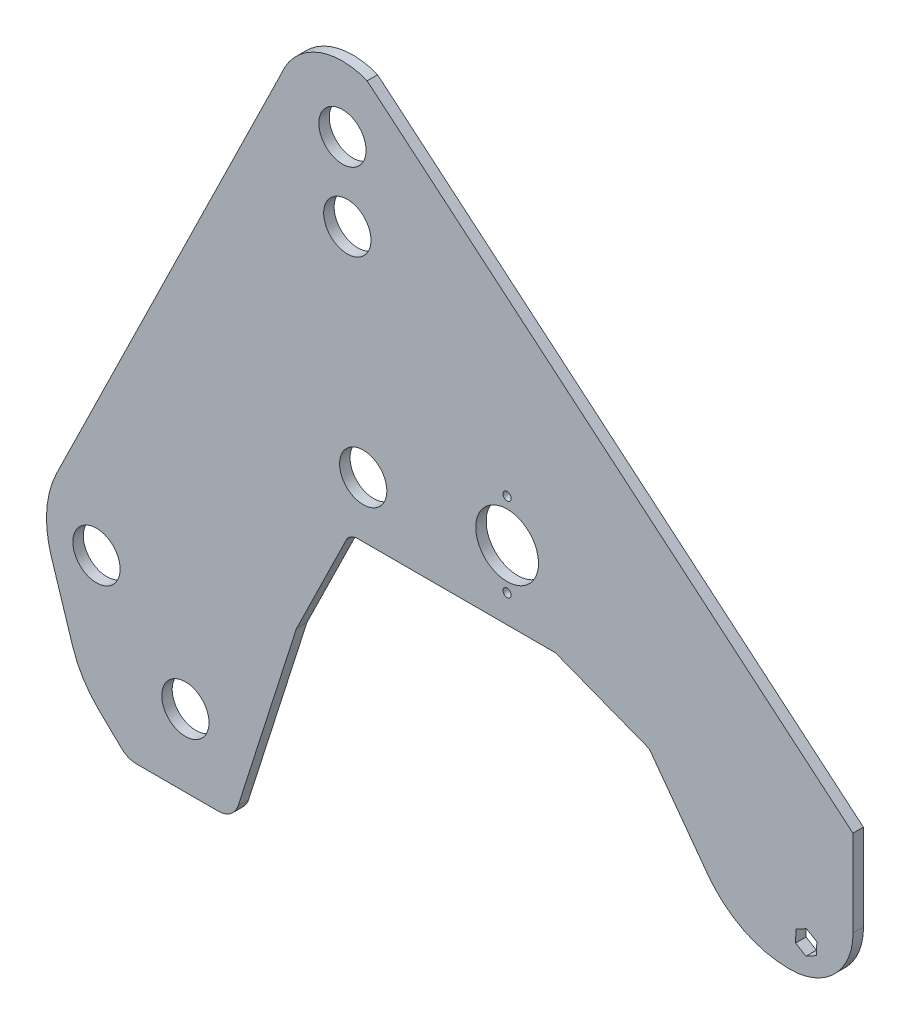
from build123d import *

# Parameters (mm, degrees)
MODEL_R             = 14.351
MODEL_R_2           = 2.4892
MODEL_R_3           = 19.05
BOSS_EXTRUDE1_DEPTH = 6.35


with BuildPart() as part:
    # Model → Boss-Extrude1 (new body)
    with BuildSketch(Plane.XY):
        with BuildLine():
            ThreePointArc((37.848526687, 2.262029163), (64.80634408, 13.438320625), (75.948496151, 40.41026636))
            Line((75.948496151, 40.41026636), (75.881988378, 92.941181044))
            Line((75.881988378, 92.941181044), (-219.021530087, 341.013342972))
            ThreePointArc((-219.021530087, 341.013342972), (-249.598102613, 340.75613417), (-271.005223477, 318.922029653))
            Line((-271.005223477, 318.922029653), (-407.447947906, 40.562687258))
            ThreePointArc((-407.447947906, 40.562687258), (-413.504414836, 18.223168878), (-410.796463755, -4.763824707))
            Line((-410.796463755, -4.763824707), (-397.757866664, -45.711795582))
            ThreePointArc((-397.757866664, -45.711795582), (-391.428206492, -59.42413889), (-381.921754905, -71.15956965))
            Line((-381.921754905, -71.15956965), (-367.938875661, -84.603641893))
            ThreePointArc((-367.938875661, -84.603641893), (-363.881347364, -87.22916938), (-359.13673651, -88.148733572))
            Line((-359.13673651, -88.148733572), (-309.438275275, -88.148733572))
            ThreePointArc((-309.438275275, -88.148733572), (-301.947346433, -85.704267936), (-297.340089739, -79.31188083))
            Line((-297.340089739, -79.31188083), (-261.934247982, 31.568293798))
            Line((-261.934247982, 31.568293798), (-231.724911987, 93.198922598))
            ThreePointArc((-231.724911987, 93.198922598), (-228.914312262, 96.311172873), (-224.882679008, 97.465081836))
            Line((-224.882679008, 97.465081836), (-104.724911987, 97.465081836))
            Line((-104.724911987, 97.465081836), (-47.735381384, 75.435922823))
            Line((-47.735381384, 75.435922823), (-12.19046228, 27.104984512))
            ThreePointArc((-12.19046228, 27.104984512), (9.400894782, 8.826180783), (36.918403373, 2.262029163))
            Line((36.918403373, 2.262029163), (37.848526687, 2.262029163))
        make_face()
        with Locations((-329.349093547, -44.473970837)):
            Circle(MODEL_R, mode=Mode.SUBTRACT)
        with Locations((-383.32390783, 9.314126574)):
            Circle(MODEL_R, mode=Mode.SUBTRACT)
        with Locations((-134.044120223, 114.3)):
            Circle(MODEL_R_2, mode=Mode.SUBTRACT)
        Polygon((47.675088013, 28.642798274), (53.94763224, 24.845625345), (53.795456135, 17.514856234), (47.370735802, 13.981260051), (41.098191575, 17.77843298), (41.25036768, 25.109202091), align=None, mode=Mode.SUBTRACT)
        with Locations((-221.405162748, 131.331748503)):
            Circle(MODEL_R, mode=Mode.SUBTRACT)
        with Locations((-231.048860216, 258.331748503)):
            Circle(MODEL_R, mode=Mode.SUBTRACT)
        with Locations((-233.999978834, 304.051748503)):
            Circle(MODEL_R, mode=Mode.SUBTRACT)
        with Locations((-134.044120223, 139.287851019)):
            Circle(MODEL_R_3, mode=Mode.SUBTRACT)
        with Locations((-134.044120223, 165.1)):
            Circle(MODEL_R_2, mode=Mode.SUBTRACT)
    extrude(amount=BOSS_EXTRUDE1_DEPTH)


solid = part.part
